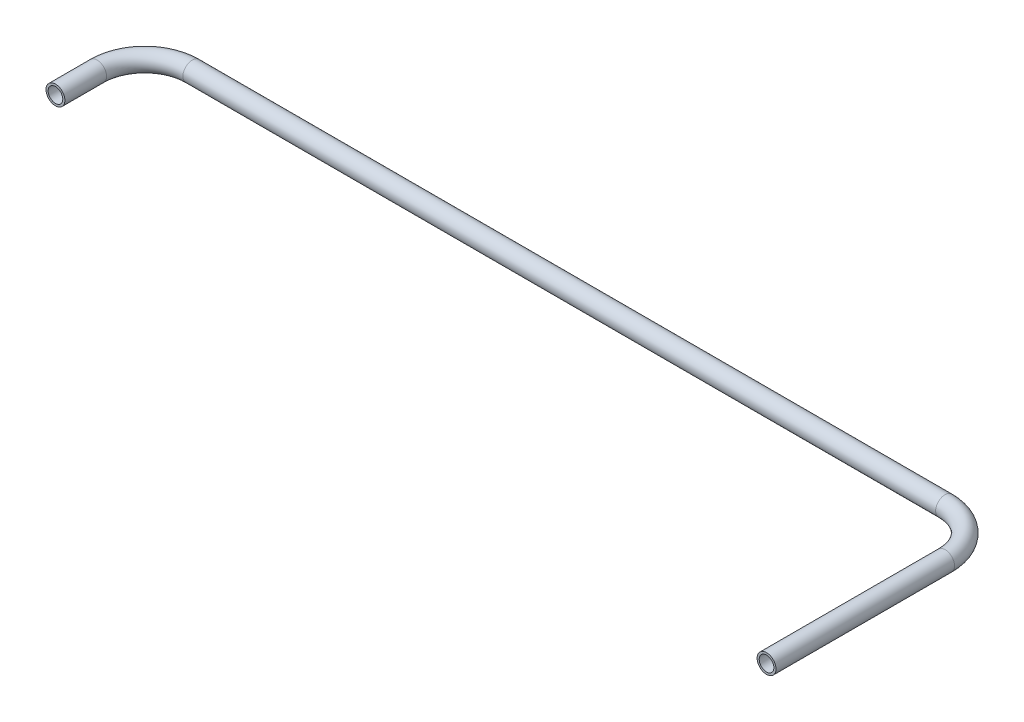
from build123d import *

# Parameters (mm, degrees)
SKETCH2_R   = 3.175
SKETCH2_R_2 = 2.4638


with BuildPart() as part:
    # Sweep-Thin1: sweep along a path in Sketch1
    with BuildLine(Plane(origin=(0, 0, 0), x_dir=(1, 0, 0), z_dir=(0, 1, 0))) as sweep_thin1_path:
        Line((0, 0), (0, 14))
        ThreePointArc((0, 14), (4.686291501, 25.313708499), (16, 30))
        Line((16, 30), (269, 30))
        ThreePointArc((269, 30), (280.313708499, 25.313708499), (285, 14))
        Line((285, 14), (285, -46))
    # Sketch2 → Sweep-Thin1 (sweep)
    with BuildSketch(Plane.XY):
        Circle(SKETCH2_R)
        Circle(SKETCH2_R_2, mode=Mode.SUBTRACT)
    sweep(path=sweep_thin1_path.line)


solid = part.part
